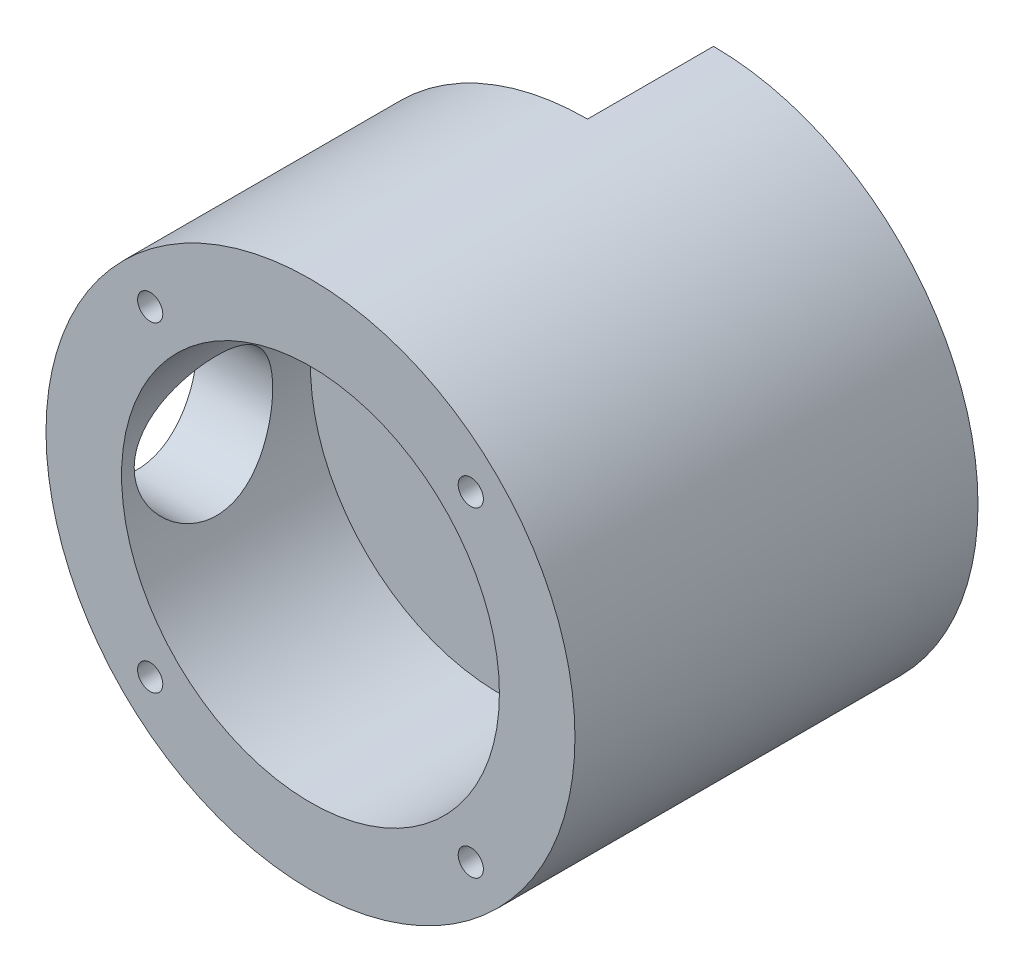
from build123d import *

# Parameters (mm, degrees)
SKETCH1_R           = 10.5
BOSS_EXTRUDE1_DEPTH = 16
SKETCH2_R           = 7.5
CUT_EXTRUDE1_DEPTH  = 7.5
SKETCH6_R           = 0.5
CUT_EXTRUDE3_DEPTH  = 7
CIRPATTERN1_COUNT   = 4
SKETCH11_R          = 2.75
CUT_EXTRUDE6_DEPTH  = 22.828879953
SKETCH13_W          = 5
SKETCH13_H          = 21
CUT_EXTRUDE8_DEPTH  = 22.828880137
SKETCH14_R          = 0.5
CUT_EXTRUDE9_DEPTH  = 2


with BuildPart() as part:
    # Sketch1 → Boss-Extrude1 (new body)
    with BuildSketch(Plane.XY):
        Circle(SKETCH1_R)
    extrude(amount=BOSS_EXTRUDE1_DEPTH)

    # Sketch2 → Cut-Extrude1 (cut)
    with BuildSketch(Plane.XY.offset(16)):
        Circle(SKETCH2_R)
    extrude(amount=-CUT_EXTRUDE1_DEPTH, mode=Mode.SUBTRACT)

    # Sketch6 → Cut-Extrude3 (cut)
    with BuildSketch(Plane.XY.offset(16)):
        with Locations((6.363961031, 6.363961031)):
            Circle(SKETCH6_R)
    cut_extrude3 = extrude(amount=-CUT_EXTRUDE3_DEPTH, mode=Mode.SUBTRACT)

    # CirPattern1: Cut-Extrude3 ×4 about axis
    cirpattern1_axis = Axis((0, 0, 16), (0, 0, 1))
    for i in range(1, CIRPATTERN1_COUNT):
        add(cut_extrude3.rotate(cirpattern1_axis, i * 360 / CIRPATTERN1_COUNT), mode=Mode.SUBTRACT)

    # Sketch9 → Cut-Revolve1 (revolve, cut)
    with BuildSketch(Plane(origin=(0, 0, 0), x_dir=(0, 0, -1), z_dir=(1, 0, 0))):
        Polygon((-5, 0), (-5, 7.5), (-2.5, 7.5), (-2.5, 5.5), (0, 5.5), (0, 0), align=None)
    revolve(axis=Axis((0, 0, 0), (0, 0, 1)), mode=Mode.SUBTRACT)

    # Sketch11 → Cut-Extrude6 (cut, through all)
    with BuildSketch(Plane(origin=(0, 0, 0), x_dir=(0, 0, -1), z_dir=(1, 0, 0))):
        with Locations((-12.75, 0)):
            Circle(SKETCH11_R)
    extrude(amount=-CUT_EXTRUDE6_DEPTH, mode=Mode.SUBTRACT)

    # Sketch13 → Cut-Extrude8 (cut, through all)
    with BuildSketch(Plane(origin=(0, 0, 0), x_dir=(0, 0, -1), z_dir=(1, 0, 0))):
        with Locations((-2.5, 0)):
            Rectangle(SKETCH13_W, SKETCH13_H)
    extrude(amount=-CUT_EXTRUDE8_DEPTH, mode=Mode.SUBTRACT)

    # Sketch14 → Cut-Extrude9 (cut)
    with BuildSketch(Plane.ZY):
        with Locations((2.5, 9)):
            Circle(SKETCH14_R)
    cut_extrude9 = extrude(amount=-CUT_EXTRUDE9_DEPTH, mode=Mode.SUBTRACT)

    # Mirror1: Cut-Extrude9 across plane
    add(cut_extrude9.mirror(Plane.ZX), mode=Mode.SUBTRACT)


solid = part.part
